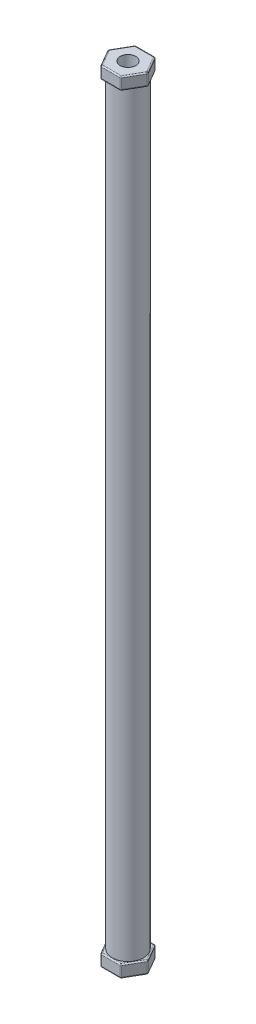
from build123d import *

# Parameters (mm, degrees)
SKETCH1_R            = 6.35
SKETCH1_R_2          = 3.175
BOSS_EXTRUDE1_DEPTH  = 304.8
SKETCH2_R            = 3.175
BOSS_EXTRUDE2_DEPTH  = 5
FILLET1_R            = 0.5
FILLET1_OF_MIRROR1_R = 0.5


with BuildPart() as part:
    # Sketch1 → Boss-Extrude1 (new body)
    with BuildSketch(Plane(origin=(0, 0, 0), x_dir=(1, 0, 0), z_dir=(0, 1, 0))):
        Circle(SKETCH1_R)
        Circle(SKETCH1_R_2, mode=Mode.SUBTRACT)
    extrude(amount=BOSS_EXTRUDE1_DEPTH)

    # Sketch2 → Boss-Extrude2 (add)
    with BuildSketch(Plane(origin=(0, 304.8, 0), x_dir=(1, 0, 0), z_dir=(0, 1, 0))):
        Polygon((-8.065583261, 0), (-4.03279163, -6.985), (4.03279163, -6.985), (8.065583261, 0), (4.03279163, 6.985), (-4.03279163, 6.985), align=None)
        Circle(SKETCH2_R, mode=Mode.SUBTRACT)
    boss_extrude2 = extrude(amount=BOSS_EXTRUDE2_DEPTH)

    # Fillet1
    fillet1_edges = [part.edges().sort_by_distance(p)[0] for p in [
        (6.049187445, 304.8, -3.4925),
        (4.03279163, 307.3, -6.985),
        (8.065583261, 307.3, 0),
        (-4.03279163, 307.3, -6.985),
        (-6.049187445, 304.8, -3.4925),
        (-8.065583261, 307.3, 0),
        (-6.049187445, 304.8, 3.4925),
        (-4.03279163, 307.3, 6.985),
        (0, 304.8, 6.985),
        (6.049187445, 304.8, 3.4925),
        (4.03279163, 307.3, 6.985),
        (6.049187445, 309.8, 3.4925),
        (6.049187445, 309.8, -3.4925),
        (0, 309.8, -6.985),
        (-6.049187445, 309.8, -3.4925),
        (-6.049187445, 309.8, 3.4925),
        (0, 309.8, 6.985),
        (0, 304.8, -6.985),
    ]]
    fillet(fillet1_edges, radius=FILLET1_R)

    # Mirror1: Boss-Extrude2 across plane
    add(boss_extrude2.mirror(Plane.ZX.offset(152.4)))

    # Fillet1 of Mirror1
    fillet1_of_mirror1_edges = [part.edges().sort_by_distance(p)[0] for p in [
        (6.049187445, 0, -3.4925),
        (4.03279163, -2.5, -6.985),
        (8.065583261, -2.5, 0),
        (-4.03279163, -2.5, -6.985),
        (-6.049187445, 0, -3.4925),
        (-8.065583261, -2.5, 0),
        (-6.049187445, 0, 3.4925),
        (-4.03279163, -2.5, 6.985),
        (0, 0, 6.985),
        (6.049187445, 0, 3.4925),
        (4.03279163, -2.5, 6.985),
        (6.049187445, -5, 3.4925),
        (6.049187445, -5, -3.4925),
        (0, -5, -6.985),
        (-6.049187445, -5, -3.4925),
        (-6.049187445, -5, 3.4925),
        (0, -5, 6.985),
        (0, 0, -6.985),
    ]]
    fillet(fillet1_of_mirror1_edges, radius=FILLET1_OF_MIRROR1_R)


solid = part.part
